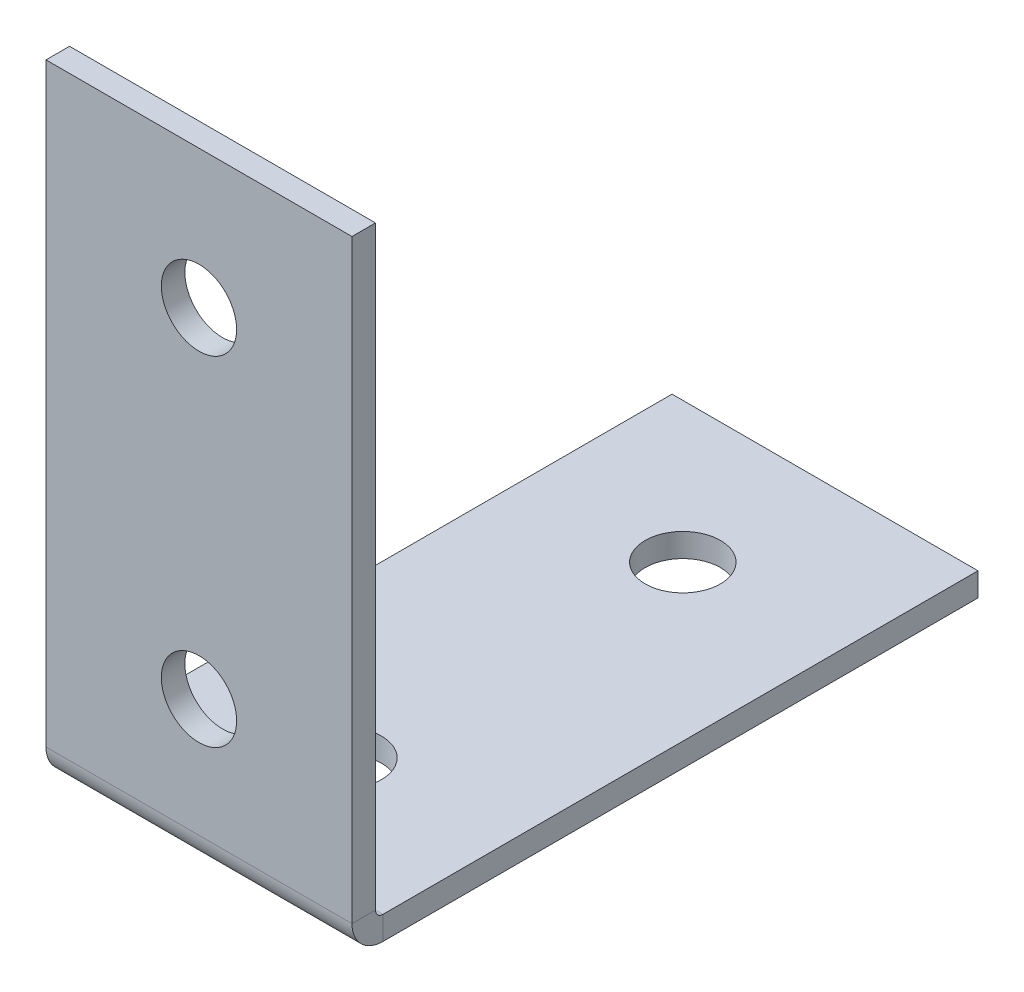
from build123d import *

# Parameters (mm, degrees)
SKETCH2_W                    = 41.275
SKETCH2_H                    = 81.28
BASE_FLANGE1_DEPTH           = 3.175
EDGE_FLANGE1_STRIP_W         = 14.7
EDGE_FLANGE1_STRIP_H         = 3.175
EDGE_FLANGE1_STRIP_CUT_DEPTH = 41.275
EDGE_FLANGE1_DEPTH           = 41.275
CUT_EXTRUDE1_REACH           = 124.133
SKETCH10_R                   = 5.08
CUT_EXTRUDE3_REACH           = 124.133
SKETCH12_R                   = 5.08


# Sheet-metal steps are written as plain solids
with BuildPart() as part:
    # Sketch2 → Base-Flange1 (new body)
    with BuildSketch(Plane(origin=(0, 0, 0), x_dir=(1, 0, 0), z_dir=(0, 1, 0))):
        with Locations((20.6375, 40.64)):
            Rectangle(SKETCH2_W, SKETCH2_H)
    extrude(amount=-BASE_FLANGE1_DEPTH)

    # Edge-Flange1 strip (across the edge) → Edge-Flange1 strip cut (cut)
    with BuildSketch(Plane(origin=(0, 0, 0), x_dir=(0, 0, -1), z_dir=(1, 0, 0))):
        with Locations((-6.35, -1.5875)):
            Rectangle(EDGE_FLANGE1_STRIP_W, EDGE_FLANGE1_STRIP_H)
    extrude(amount=EDGE_FLANGE1_STRIP_CUT_DEPTH, mode=Mode.SUBTRACT)

    # Edge-Flange1 section (across the edge) → Edge-Flange1 (add)
    with BuildSketch(Plane(origin=(0, 0, 0), x_dir=(0, 0, -1), z_dir=(1, 0, 0))):
        with BuildLine():
            Line((-3.175, 1), (-3.175, 81.28))
            Line((-3.175, 81.28), (0, 81.28))
            Line((0, 81.28), (0, 1))
            ThreePointArc((0, 1), (0.292893219, 0.292893219), (1, 0))
            Line((1, 0), (1, -3.175))
            ThreePointArc((1, -3.175), (-1.952170811, -1.952170811), (-3.175, 1))
        make_face()
    extrude(amount=EDGE_FLANGE1_DEPTH)

    # Sketch10 → Cut-Extrude1 (cut, up to next)
    with BuildSketch(Plane(origin=(0, 0, 0), x_dir=(-1, 0, 0), z_dir=(0, 0, -1)), mode=Mode.PRIVATE) as cut_extrude1_sk1:
        with Locations((-20.6375, 62.638675326)):
            Circle(SKETCH10_R)
    cut_extrude1_tool1 = extrude(cut_extrude1_sk1.sketch, amount=-CUT_EXTRUDE1_REACH, mode=Mode.PRIVATE) & part.part
    # Sketch10 → Cut-Extrude1 (cut, up to next)
    with BuildSketch(Plane(origin=(0, 0, 0), x_dir=(-1, 0, 0), z_dir=(0, 0, -1)), mode=Mode.PRIVATE) as cut_extrude1_sk2:
        with Locations((-20.6375, 16.918675326)):
            Circle(SKETCH10_R)
    cut_extrude1_tool2 = extrude(cut_extrude1_sk2.sketch, amount=-CUT_EXTRUDE1_REACH, mode=Mode.PRIVATE) & part.part
    add(cut_extrude1_tool1.solids().sort_by_distance((20.6375, 62.638675, 0))[0], mode=Mode.SUBTRACT)
    add(cut_extrude1_tool2.solids().sort_by_distance((20.6375, 16.918675, 0))[0], mode=Mode.SUBTRACT)

    # Sketch12 → Cut-Extrude3 (cut, up to next)
    with BuildSketch(Plane(origin=(0, 0, 0), x_dir=(1, 0, 0), z_dir=(0, 1, 0)), mode=Mode.PRIVATE) as cut_extrude3_sk1:
        with Locations(Location((20.359792254, 16.65462957, 0), (0, 0, 270))):
            Circle(SKETCH12_R)
    cut_extrude3_tool1 = extrude(cut_extrude3_sk1.sketch, amount=-CUT_EXTRUDE3_REACH, mode=Mode.PRIVATE) & part.part
    # Sketch12 → Cut-Extrude3 (cut, up to next)
    with BuildSketch(Plane(origin=(0, 0, 0), x_dir=(1, 0, 0), z_dir=(0, 1, 0)), mode=Mode.PRIVATE) as cut_extrude3_sk2:
        with Locations(Location((20.360011307, 62.374629569, 0), (0, 0, 270))):
            Circle(SKETCH12_R)
    cut_extrude3_tool2 = extrude(cut_extrude3_sk2.sketch, amount=-CUT_EXTRUDE3_REACH, mode=Mode.PRIVATE) & part.part
    add(cut_extrude3_tool1.solids().sort_by_distance((20.359792, 0, -16.65463))[0], mode=Mode.SUBTRACT)
    add(cut_extrude3_tool2.solids().sort_by_distance((20.360011, 0, -62.37463))[0], mode=Mode.SUBTRACT)


solid = part.part
